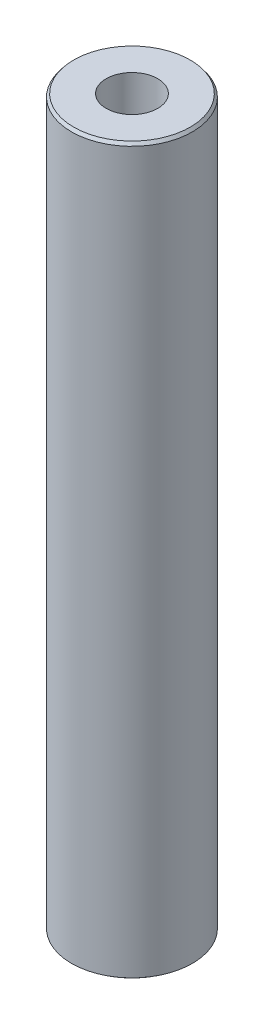
from build123d import *
from OCP.BRepFilletAPI import BRepFilletAPI_MakeChamfer

# Parameters (mm, degrees)
SKETCH1_R           = 50
BOSS_EXTRUDE1_DEPTH = 600
SKETCH2_R           = 21.325599196
CUT_EXTRUDE1_DEPTH  = 605.15229868
CHAMFER1_SIZE       = 2.457108323
CHAMFER1_SIZE2      = 1.823911047


with BuildPart() as part:
    # Sketch1 → Boss-Extrude1 (new body)
    with BuildSketch(Plane(origin=(0, 0, 0), x_dir=(1, 0, 0), z_dir=(0, 1, 0))):
        Circle(SKETCH1_R)
    extrude(amount=BOSS_EXTRUDE1_DEPTH)

    # Sketch2 → Cut-Extrude1 (cut, through all)
    with BuildSketch(Plane(origin=(0, 0, 0), x_dir=(1, 0, 0), z_dir=(0, 1, 0))):
        Circle(SKETCH2_R)
    extrude(amount=CUT_EXTRUDE1_DEPTH, mode=Mode.SUBTRACT)

    # Chamfer1: one chamfer whose edges measure the first distance from different faces: ONE call of the kernel's chamfer builder (chamfer() names one face for all edges)
    chamfer1_edges_1 = [part.edges().sort_by_distance(p)[0] for p in [
        (-50, 600, 0),
    ]]
    chamfer1_side_1 = [part.faces().sort_by_distance(p)[0] for p in [
        (-50, 300, 0),
    ]]
    chamfer1_edges_2 = [part.edges().sort_by_distance(p)[0] for p in [
        (-50, 0, 0),
    ]]
    chamfer1_side_2 = [part.faces().sort_by_distance(p)[0] for p in [
        (-48.585786438, 0, 0),
    ]]
    chamfer1 = BRepFilletAPI_MakeChamfer(part.part.solid().wrapped)
    for e in chamfer1_edges_1:
        chamfer1.Add(CHAMFER1_SIZE, CHAMFER1_SIZE2, e.wrapped, chamfer1_side_1[0].wrapped)  # the first distance lies on this face
    for e in chamfer1_edges_2:
        chamfer1.Add(CHAMFER1_SIZE, CHAMFER1_SIZE2, e.wrapped, chamfer1_side_2[0].wrapped)  # the first distance lies on this face
    add(Compound.cast(chamfer1.Shape()), mode=Mode.REPLACE)


solid = part.part
